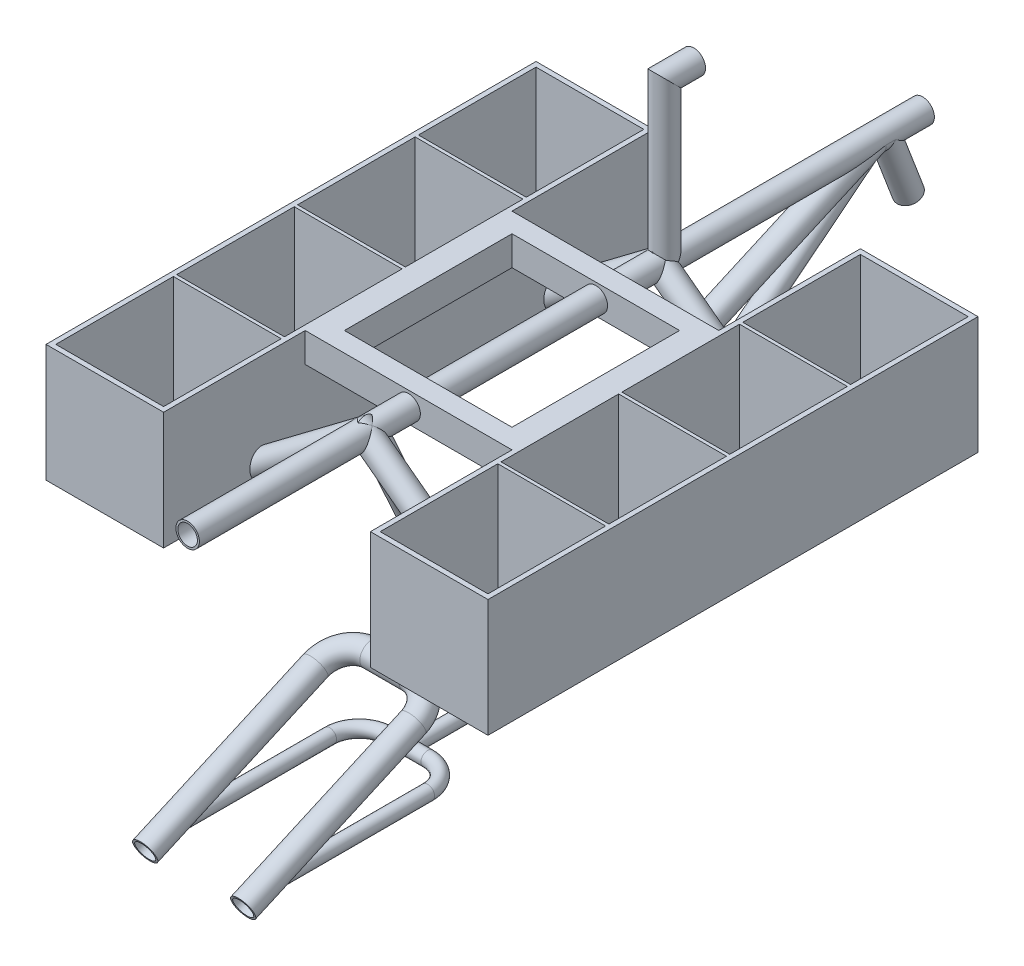
from build123d import *
from build123d.topology import SkipClean

# Parameters (mm, degrees)
SWEEP1_PROFILE_R         = 10
SKETCH25_R               = 9.000000000000004
CUT_EXTRUDE2_DEPTH       = 521.3652975499805
SWEEP_THIN3_PROFILE_R    = 12
SWEEP_THIN3_PROFILE_R_2  = 10
SWEEP_THIN4_PROFILE_R    = 12
SWEEP_THIN4_PROFILE_R_2  = 10
SKETCH62_W               = 211.00000000000003
SKETCH62_H               = 210.99999999999997
BOSS_EXTRUDE2_DEPTH      = 15
SWEEP_THIN5_PROFILE_R    = 12
SWEEP_THIN5_PROFILE_R_2  = 10
BOSS_EXTRUDE3_START      = -100
SKETCH90_W               = 119.99999999999999
SKETCH90_H               = 500
BOSS_EXTRUDE3_DEPTH      = 115
SKETCH91_W               = 119.99999999999999
SKETCH91_H               = 500
BOSS_EXTRUDE4_DEPTH      = 5
SKETCH93_W               = 109.99999999999996
SKETCH93_H               = 3.3333333333333144
BOSS_EXTRUDE5_DEPTH      = 115
SWEEP_THIN8_PROFILE_R    = 12
SWEEP_THIN8_PROFILE_R_2  = 10
SKETCH130_R              = 11.999999999999975
BOSS_EXTRUDE6_DEPTH      = 2
SKETCH131_W              = 109.99999999999993
SKETCH131_H              = 120.00000000000003
CUT_EXTRUDE3_DEPTH       = 553.6836800009568
SWEEP_THIN9_PROFILE_R    = 12
SWEEP_THIN9_PROFILE_R_2  = 10
SWEEP_THIN10_PROFILE_R   = 12
SWEEP_THIN10_PROFILE_R_2 = 10
SWEEP_THIN11_PROFILE_R   = 7
SWEEP_THIN11_PROFILE_R_2 = 5
SWEEP_THIN12_START       = -171.847587578
SWEEP_THIN12_OUTLINE_R   = 10
SWEEP_THIN12_DEPTH       = 70


with BuildPart() as part:
    # Sweep1: sweep along a path in Sketch5
    with BuildLine(Plane(origin=(0, 0, 0), x_dir=(0, 0, -1), z_dir=(1, 0, 0))) as sweep1_path:
        Line((-102.25091595539637, -300), (275.39365772733277, 0))
    # Sweep1 profile (on start of the path) → Sweep1 (sweep)
    with BuildSketch(Plane(origin=(0, -300, 102.25091595539637), x_dir=(0, -0.7830040253128674, -0.6220166367098604), z_dir=(0, 0.6220166367098604, -0.7830040253128674))):
        Circle(SWEEP1_PROFILE_R)
    sweep(path=sweep1_path.line)

    # Sketch25 → Cut-Extrude2 (cut, through all)
    with BuildSketch(Plane(origin=(0, -165.87185149031097, 208.80201547341127), x_dir=(1, 0, 0), z_dir=(0, -0.6220166367098607, 0.7830040253128673))):
        with Locations(Location((0, -171.2994367507819, 0), (0, 0, 270))):
            Circle(SKETCH25_R)
    extrude(amount=-CUT_EXTRUDE2_DEPTH, mode=Mode.SUBTRACT)

    # Sweep-Thin3: sweep along a path in Sketch7
    with BuildLine(Plane(origin=(0, 0, 0), x_dir=(1, 0, 0), z_dir=(0, 1, 0))) as sweep_thin3_path:
        Line((1.1276e-13, 325), (1.1276e-13, -425))
    # Sweep-Thin3 profile (on start of the path) → Sweep-Thin3 (sweep)
    with BuildSketch(Plane.XY.offset(-325)):
        Circle(SWEEP_THIN3_PROFILE_R)
        Circle(SWEEP_THIN3_PROFILE_R_2, mode=Mode.SUBTRACT)
    sweep(path=sweep_thin3_path.line)

    # Sweep-Thin4: sweep along a path in Sketch50
    with BuildLine(Plane(origin=(0, 0, 0), x_dir=(0, 0, -1), z_dir=(1, 0, 0))) as sweep_thin4_path:
        Line((-238.60549827668777, 0), (-102.25091595539637, -300))
        Line((-102.25091595539637, -300), (-95.93980072974016, -313.8853754341428))
    # Sweep-Thin4 profile (on start of the path) → Sweep-Thin4 (sweep)
    with BuildSketch(Plane(origin=(0, 0, 238.60549827668777), x_dir=(0, 0.41378017354544266, -0.9103768274625093), z_dir=(0, -0.9103768274625093, -0.41378017354544266))):
        Circle(SWEEP_THIN4_PROFILE_R)
        Circle(SWEEP_THIN4_PROFILE_R_2, mode=Mode.SUBTRACT)
    sweep(path=sweep_thin4_path.line)

    # Sketch62 → Boss-Extrude2 (add, symmetric)
    with BuildSketch(Plane(origin=(0, 0, 0), x_dir=(1, 0, 0), z_dir=(0, 1, 0))):
        with Locations((0, -94.00549827668773)):
            Rectangle(SKETCH62_W, SKETCH62_H)
        Polygon((-85.49999999999999, -8.505498276687739), (-85.49999999999999, -179.50549827668775), (85.49999999999999, -179.50549827668775), (85.5, -8.505498276687739), align=None, mode=Mode.SUBTRACT)
    extrude(amount=BOSS_EXTRUDE2_DEPTH, both=True)

    # Sweep-Thin5: sweep along a path in Sketch67
    with BuildLine(Plane(origin=(0, 0, 0), x_dir=(0, 0, -1), z_dir=(1, 0, 0))) as sweep_thin5_path:
        Line((61.49450172331229, 0), (61.49450172331229, 160))
        Line((61.49450172331229, 160), (91.4945017233123, 160))
    # Sweep-Thin5 profile (on start of the path) → Sweep-Thin5 (sweep)
    with BuildSketch(Plane(origin=(0, 0, -61.49450172331229), x_dir=(0, 0, 1), z_dir=(0, 1, 0))):
        Circle(SWEEP_THIN5_PROFILE_R)
        Circle(SWEEP_THIN5_PROFILE_R_2, mode=Mode.SUBTRACT)
    sweep(path=sweep_thin5_path.line, transition=Transition.RIGHT)

    # Sketch90 → Boss-Extrude3 (add)
    with BuildSketch(Plane(origin=(0, 0, 0), x_dir=(1, 0, 0), z_dir=(0, 1, 0)).offset(BOSS_EXTRUDE3_START)):
        with Locations((165.49999999999997, -94.00549827668773)):
            Rectangle(SKETCH90_W, SKETCH90_H)
        Polygon((110.5, 150.99450172331225), (110.50000000000006, -339.0054982766877), (220.49999999999997, -339.0054982766877), (220.49999999999991, 150.99450172331225), align=None, mode=Mode.SUBTRACT)
    boss_extrude3 = extrude(amount=BOSS_EXTRUDE3_DEPTH)

    # Sketch91 → Boss-Extrude4 (add)
    with BuildSketch(Plane.XZ.offset(100)):
        with Locations((165.49999999999997, 94.00549827668773)):
            Rectangle(SKETCH91_W, SKETCH91_H)
    boss_extrude4 = extrude(amount=BOSS_EXTRUDE4_DEPTH)

    # Mirror1: Boss-Extrude3 across plane
    add(boss_extrude3.mirror(Plane(origin=(0, 0, 0), x_dir=(0, 0, 1), z_dir=(1, 0, 0))))

    # Sketch93 → Boss-Extrude5 (add)
    with BuildSketch(Plane(origin=(0, -100, 0), x_dir=(1, 0, 0), z_dir=(0, 1, 0))):
        with Locations((165.5, -217.33883161002103)):
            Rectangle(SKETCH93_W, SKETCH93_H)
        Polygon((110.49999999999999, -92.33883161002102), (110.49999999999999, -95.67216494335437), (220.49999999999994, -95.67216494335437), (220.49999999999994, -92.33883161002105), align=None)
        Polygon((110.49999999999997, 30.994501723312307), (110.49999999999997, 27.66116838997895), (220.49999999999994, 27.66116838997895), (220.49999999999994, 30.99450172331228), align=None)
    boss_extrude5 = extrude(amount=BOSS_EXTRUDE5_DEPTH)

    # Mirror2: Boss-Extrude4, Boss-Extrude5 across plane
    add(boss_extrude4.mirror(Plane(origin=(0, 0, 0), x_dir=(0, 0, 1), z_dir=(1, 0, 0))))
    add(boss_extrude5.mirror(Plane(origin=(0, 0, 0), x_dir=(0, 0, 1), z_dir=(1, 0, 0))))

    # Sweep-Thin8: sweep along a path in Sketch103
    with BuildLine(Plane.XY.offset(244.0054982766877)) as sweep_thin8_path:
        Line((112.79880983773536, -85), (0, 0))
        Line((0, 0), (-112.79880983773533, -85))
    # Sweep-Thin8 profile (on start of the path) → Sweep-Thin8 (sweep)
    with BuildSketch(Plane(origin=(112.79880983773536, -85, 244.0054982766877), x_dir=(-0.6018150231520466, -0.7986355100472942, 0), z_dir=(-0.7986355100472942, 0.6018150231520466, 0))):
        Circle(SWEEP_THIN8_PROFILE_R)
        Circle(SWEEP_THIN8_PROFILE_R_2, mode=Mode.SUBTRACT)
    sweep_thin8 = sweep(path=sweep_thin8_path.line, transition=Transition.RIGHT)

    # Mirror3: Sweep-Thin8 across plane
    add(sweep_thin8.mirror(Plane.XY.offset(94.00549827668775)))

    # Sketch130 → Boss-Extrude6 (add)
    with BuildSketch(Plane(origin=(0, -224.0036668920759, -101.81308812502276), x_dir=(1, 0, 0), z_dir=(0, -0.9103768274625086, -0.4137801735454441))):
        with Locations(Location((0, 217.2209165362426, 0), (0, 0, 198.775546457))):
            Circle(SKETCH130_R)
    extrude(amount=-BOSS_EXTRUDE6_DEPTH)

    # Sketch131 → Cut-Extrude3 (cut, through all)
    with BuildSketch(Plane(origin=(0, -100, 0), x_dir=(1, 0, 0), z_dir=(0, 1, 0))):
        Polygon((110.49999999999997, 30.994501723312307), (220.49999999999994, 30.99450172331228), (220.49999999999991, 150.99450172331225), (110.5, 150.99450172331225), align=None)
        Polygon((-220.49999999999991, 150.99450172331225), (-220.49999999999991, 30.99450172331228), (-110.50000000000001, 30.994501723312307), (-110.5, 150.99450172331225), align=None)
        with Locations((165.5, -279.0054982766877)):
            Rectangle(SKETCH131_W, SKETCH131_H)
        Polygon((-110.50000000000006, -339.0054982766877), (-110.5, -219.0054982766877), (-220.49999999999997, -219.0054982766877), (-220.49999999999997, -339.0054982766877), align=None)
    extrude(amount=CUT_EXTRUDE3_DEPTH, mode=Mode.SUBTRACT)



with BuildPart() as body_2:
    # Sweep-Thin9: sweep along a path in Sketch139
    with BuildLine(Plane(origin=(0, -300, 400.00000000000006), x_dir=(1, 0, 0), z_dir=(0, 0.913899390723764, 0.4059407637017167))) as sweep_thin9_path:
        Line((-49.999999999999986, -19.999999999999936), (-49.99999999999997, 170.00000000000006))
        ThreePointArc((-49.99999999999997, 170.00000000000006), (-41.213203435596384, 191.21320343559648), (-19.999999999999968, 200.00000000000006))
        Line((-19.999999999999968, 200.00000000000006), (19.999999999999968, 200.00000000000006))
        ThreePointArc((19.999999999999968, 200.00000000000006), (41.2132034355964, 191.21320343559648), (49.99999999999997, 170.00000000000006))
        Line((49.99999999999997, 170.00000000000006), (49.999999999999986, -19.999999999999936))
    # Sweep-Thin9 profile (on start of the path) → Sweep-Thin9 (sweep)
    with BuildSketch(Plane(origin=(-49.999999999999986, -308.1188152740343, 418.2779878144753), x_dir=(0, -0.913899390723764, -0.4059407637017167), z_dir=(0, 0.4059407637017167, -0.913899390723764))):
        Circle(SWEEP_THIN9_PROFILE_R)
        Circle(SWEEP_THIN9_PROFILE_R_2, mode=Mode.SUBTRACT)
    sweep(path=sweep_thin9_path.line)


with BuildPart() as part_1:
    add(part.part)

    add(body_2.part)  # Sweep-Thin10 merges body 2
    # Sweep-Thin10: sweep along a path in Sketch148
    with BuildLine(Plane(origin=(0, -300, 400.00000000000006), x_dir=(1, 0, 0), z_dir=(0, 0.913899390723764, 0.4059407637017167))) as sweep_thin10_path:
        Line((-4.899e-14, 200.00000000000006), (0, 739.0240814062188))
    # Sweep-Thin10 profile (on start of the path) → Sweep-Thin10 (sweep)
    with BuildSketch(Plane(origin=(-4.899e-14, -218.81184725965664, 217.22012185524719), x_dir=(0, -0.913899390723764, -0.4059407637017167), z_dir=(0, 0.4059407637017167, -0.913899390723764))):
        Circle(SWEEP_THIN10_PROFILE_R)
        Circle(SWEEP_THIN10_PROFILE_R_2, mode=Mode.SUBTRACT)
    sweep(path=sweep_thin10_path.line)

    # Sweep-Thin11: sweep along a path in Sketch209
    with BuildLine(Plane(origin=(0, -300, 399.99999999999994), x_dir=(-1, 0, 0), z_dir=(0, -1, -1.4e-16))) as sweep_thin11_path:
        Line((0, 297.7490840446036), (1.197e-14, 200.00000000000006))
        Line((1.197e-14, 200.00000000000006), (-19.99999999999978, 200.00000000000006))
        ThreePointArc((-19.99999999999978, 200.00000000000006), (-41.21320343559641, 191.21320343559648), (-49.99999999999998, 169.99999999999986))
        Line((-49.99999999999998, 169.99999999999986), (-49.999999999999964, 5.551e-14))
    # Sweep-Thin11 profile (on start of the path) → Sweep-Thin11 (sweep)
    with BuildSketch(Plane(origin=(0, -299.99999999999994, 102.25091595539635), x_dir=(0, 1, 1.4e-16), z_dir=(-1.2e-16, -1.4e-16, 1))):
        Circle(SWEEP_THIN11_PROFILE_R)
        Circle(SWEEP_THIN11_PROFILE_R_2, mode=Mode.SUBTRACT)
    sweep_thin11 = sweep(path=sweep_thin11_path.line, transition=Transition.RIGHT)

    # Mirror4: Sweep-Thin11 across plane
    add(sweep_thin11.mirror(Plane(origin=(0, 0, 0), x_dir=(0, 0, 1), z_dir=(1, 0, 0))))

    # Sweep-Thin12: read off the stored shape, not the designer's step
    # Sweep-Thin12 outline → Sweep-Thin12 (add)
    with SkipClean():  # the faces are left unmerged after this step: merging them gives an invalid solid
        with BuildSketch(Plane(origin=(0, 0, 0), x_dir=(1, 0, 0), z_dir=(0, 0.934155191329314, 0.356867031977588)).offset(SWEEP_THIN12_START)):
            with BuildLine():
                ThreePointArc((-10.000281373, 273.234792313), (0.000253618, 254.601966941), (10.000000996, 273.235215017))
                ThreePointArc((10.000000996, 273.235215017), (-0.000253618, 278.601966936), (-10.000281373, 273.234792313))
            make_face()
            with Locations((0, 266.601966938)):
                Circle(SWEEP_THIN12_OUTLINE_R, mode=Mode.SUBTRACT)
        extrude(amount=SWEEP_THIN12_DEPTH)


solid = part_1.part
